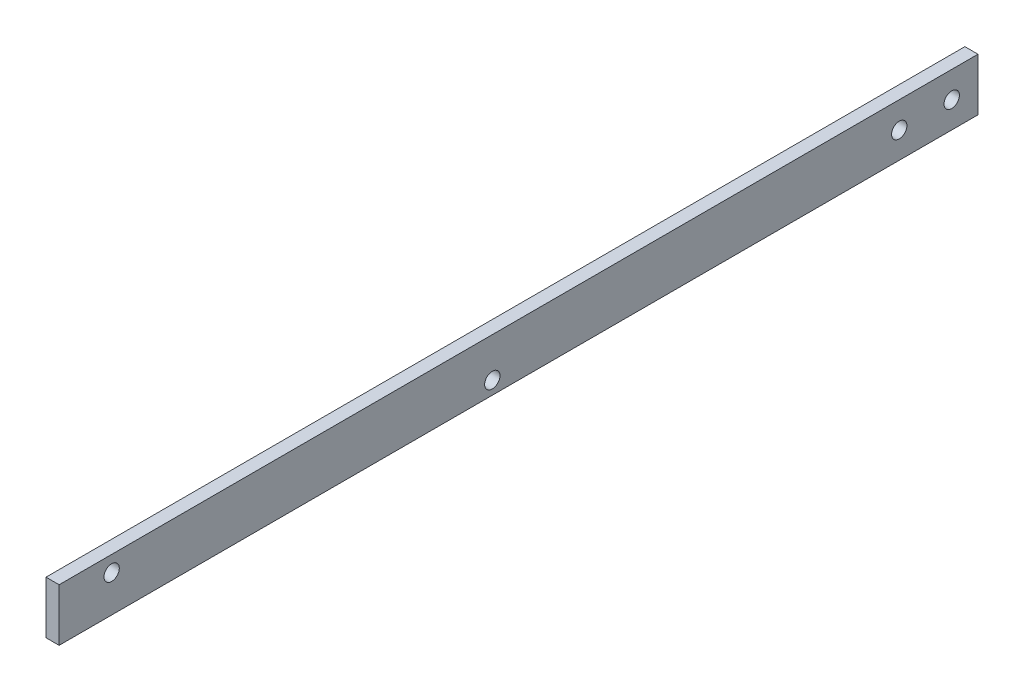
from build123d import *

# Parameters (mm, degrees)
SKETCH1_W                  = 3.175
SKETCH1_H                  = 12.7
BOSS_EXTRUDE1_DEPTH        = 222.25
F_6_0_146_DIAMETER_HOLE1_D = 3.7084
F_6_0_146_DIAMETER_HOLE2_D = 3.7084
F_6_0_146_DIAMETER_HOLE3_D = 3.7084


with BuildPart() as part:
    # Sketch1 → Boss-Extrude1 (new body)
    with BuildSketch(Plane.XY):
        with Locations((1.5875, -6.35)):
            Rectangle(SKETCH1_W, SKETCH1_H)
    extrude(amount=BOSS_EXTRUDE1_DEPTH)

    # #6 (0.146) Diameter Hole1 (through all)
    with Locations(Plane(origin=(3.175, -3.81, 209.55), x_dir=(0, 1, 0), z_dir=(1, 0, 0))):
        with Locations((0, 0)):
            Hole(F_6_0_146_DIAMETER_HOLE1_D / 2)

    # #6 (0.146) Diameter Hole2 (through all)
    with Locations(Plane(origin=(3.175, -9.525, 117.475), x_dir=(0, 1, 0), z_dir=(1, 0, 0))):
        with Locations((0, 0)):
            Hole(F_6_0_146_DIAMETER_HOLE2_D / 2)

    # #6 (0.146) Diameter Hole3 (through all)
    with Locations(Plane(origin=(3.175, -6.35, 6.35), x_dir=(0, 1, 0), z_dir=(1, 0, 0))):
        with Locations((0, 0), (0, 12.7)):
            Hole(F_6_0_146_DIAMETER_HOLE3_D / 2)


solid = part.part
